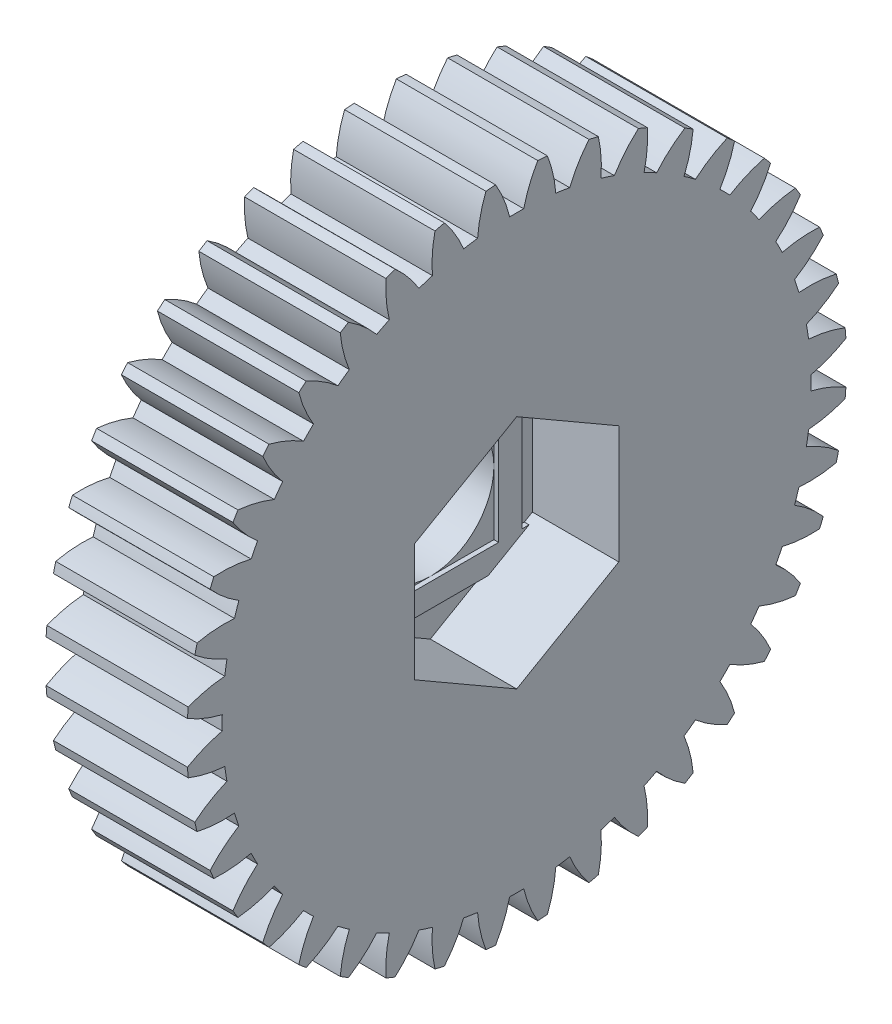
from build123d import *

# Parameters (mm, degrees)
BASPROSKE_W         = 9
BASPROSKE_H         = 21
TOOTHCUT_DEPTH      = 32.032241298
TEETHCUTS_COUNT     = 40
TEETHCUTS_ANGLE     = 351
BORSKE_R            = 2
BORE_DEPTH          = 50.0000508
CUT_EXTRUDE1_DEPTH  = 5.5
SKETCH1_7_R         = 4.05
CUT_EXTRUDE2_DEPTH  = 31.974304622
SKETCH2_R           = 6
SKETCH2_R_2         = 4
BOSS_EXTRUDE1_DEPTH = 2.3
SKETCH3_W           = 8.1
SKETCH3_H           = 8.1
BOSS_EXTRUDE2_DEPTH = 0.3


with BuildPart() as part:
    # BasProSke → Base-Revolve (revolve)
    with BuildSketch(Plane(origin=(0, 0, 0), x_dir=(1, 0, 0), z_dir=(0, 1, 0))):
        with Locations((4.5, 10.5)):
            Rectangle(BASPROSKE_W, BASPROSKE_H)
    revolve(axis=Axis((-10, 0, 0), (1, 0, 0)))

    # TooCutSke → ToothCut (cut, through all)
    with BuildSketch(Plane(origin=(0, 0, 0), x_dir=(0, 0, -1), z_dir=(1, 0, 0))):
        with BuildLine():
            ThreePointArc((0.448673268, 18.74363074), (0, 18.749), (-0.448673268, 18.74363074))
            ThreePointArc((-0.448673268, 18.74363074), (-0.816786816, 19.89705013), (-1.354745081, 20.981708961))
            ThreePointArc((-1.354745081, 20.981708961), (0, 21.0254), (1.354745081, 20.981708961))
            ThreePointArc((1.354745081, 20.981708961), (0.816786816, 19.89705013), (0.448673268, 18.74363074))
        make_face()
    toothcut = extrude(amount=TOOTHCUT_DEPTH, mode=Mode.SUBTRACT)

    # TeethCuts: ToothCut ×40 about axis
    teethcuts_axis = Axis((-10, 0, 0), (1, 0, 0))
    for i in range(1, TEETHCUTS_COUNT):
        add(toothcut.rotate(teethcuts_axis, i * TEETHCUTS_ANGLE / (TEETHCUTS_COUNT - 1)), mode=Mode.SUBTRACT)

    # BorSke → Bore (cut, symmetric)
    with BuildSketch(Plane(origin=(0, 0, 0), x_dir=(0, 0, -1), z_dir=(1, 0, 0))):
        Circle(BORSKE_R)
    extrude(amount=BORE_DEPTH, both=True, mode=Mode.SUBTRACT)

    # Sketch1 → Cut-Extrude1 (cut)
    with BuildSketch(Plane(origin=(9, 0, 0), x_dir=(0, 0, -1), z_dir=(1, 0, 0))):
        Polygon((0, 7.505553499), (-6.5, 3.75277675), (-6.5, -3.75277675), (0, -7.505553499), (6.5, -3.75277675), (6.5, 3.75277675), align=None)
    extrude(amount=-CUT_EXTRUDE1_DEPTH, mode=Mode.SUBTRACT)

    # Sketch1<7> → Cut-Extrude2 (cut, through all)
    with BuildSketch(Plane(origin=(9, 0, 0), x_dir=(0, 0, -1), z_dir=(1, 0, 0))):
        Circle(SKETCH1_7_R)
    extrude(amount=-CUT_EXTRUDE2_DEPTH, mode=Mode.SUBTRACT)

    # Sketch2 → Boss-Extrude1 (add)
    with BuildSketch(Plane.ZY):
        Circle(SKETCH2_R)
        Circle(SKETCH2_R_2, mode=Mode.SUBTRACT)
    extrude(amount=BOSS_EXTRUDE1_DEPTH)

    # Sketch3 → Boss-Extrude2 (add)
    with BuildSketch(Plane(origin=(3.5, 0, 0), x_dir=(0, 0, -1), z_dir=(1, 0, 0))):
        Polygon((5.55, -4.05), (5.55, 4.05), (5.985194229, 4.05), (3.387118018, 5.55), (-3.387118018, 5.55), (-5.985194229, 4.05), (-5.55, 4.05), (-5.55, -4.05), (-5.985194229, -4.05), (-3.387118018, -5.55), (3.387118018, -5.55), (5.985194229, -4.05), align=None)
        Rectangle(SKETCH3_W, SKETCH3_H, mode=Mode.SUBTRACT)
    extrude(amount=BOSS_EXTRUDE2_DEPTH)


solid = part.part
